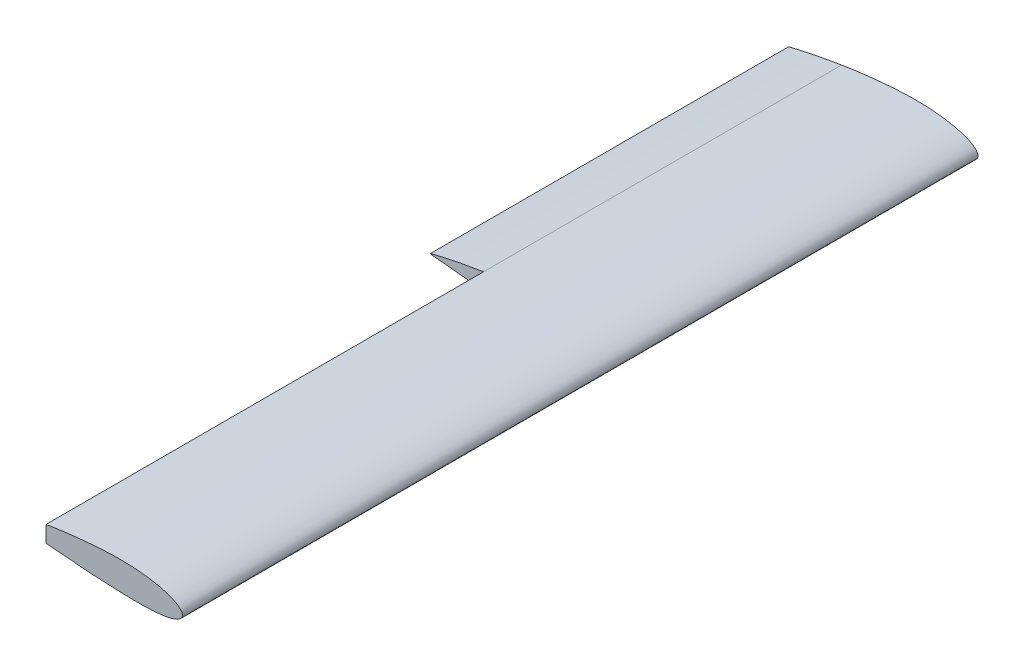
from build123d import *

# Parameters (mm, degrees)
BOSS_EXTRUDE1_DEPTH = 1120
BOSS_EXTRUDE2_DEPTH = 504
SKETCH3_R           = 12.7
CUT_EXTRUDE1_DEPTH  = 801
SKETCH4_W           = 32
SKETCH4_H           = 36.699
CUT_EXTRUDE2_DEPTH  = 46
SKETCH5_W           = 60
SKETCH5_H           = 12
CUT_EXTRUDE3_DEPTH  = 46
SKETCH6_W           = 54
SKETCH6_H           = 29.1
CUT_EXTRUDE4_DEPTH  = 64
SKETCH7_W           = 20.4
SKETCH7_H           = 6.8
CUT_EXTRUDE5_DEPTH  = 26


with BuildPart() as part:
    # Sketch1 → Boss-Extrude1 (new body)
    with BuildSketch(Plane.XY):
        with BuildLine():
            Line((-191.93544, 15.415994386), (-191.93544, -7.690938633))
            add(Edge.make_bspline(
                [(-191.93544, 15.415994386), (-189.524263645, 15.800399619), (-183.840015022, 16.706619074), (-174.781136721, 18.029343411), (-164.699001073, 19.401069917), (-154.413191944, 20.673735856), (-143.988170783, 21.830432901), (-133.488738685, 22.849158456), (-122.980748105, 23.710765794), (-112.515417187, 24.396095093), (-102.139321575, 24.893723734), (-91.916475809, 25.125832859), (-81.930286803, 25.090046311), (-72.266831195, 24.780871286), (-62.991070612, 24.200812347), (-54.165224939, 23.356898581), (-45.848172705, 22.261450678), (-38.094792214, 20.931595824), (-30.955366589, 19.388795281), (-24.475027042, 17.658061869), (-18.693227651, 15.766937372), (-13.643188102, 13.744216819), (-9.351263596, 11.618189035), (-5.83608943, 9.414274451), (-3.108519117, 7.149904568), (-1.175256134, 4.827939872), (-0.063283786, 2.426466328), (0.145020659, -0.01456545), (-0.541831171, -2.364092475), (-2.092939689, -4.498687379), (-4.413682401, -6.404391962), (-7.476250194, -8.116874818), (-11.268094049, -9.647026376), (-15.771581276, -10.99526881), (-20.962122659, -12.158099265), (-26.809437569, -13.132372723), (-33.278882983, -13.916792281), (-40.332337427, -14.512824611), (-47.92878569, -14.925150527), (-56.024697843, -15.161881697), (-64.574273602, -15.234523302), (-73.529599748, -15.15778324), (-82.840735601, -14.948927871), (-92.455830845, -14.627964828), (-102.340307767, -14.21298414), (-112.453303072, -13.731946661), (-122.732635144, -13.141710162), (-133.097571213, -12.46700742), (-143.470724362, -11.725475749), (-153.789329166, -10.934787918), (-163.990582264, -10.110993441), (-174.011944986, -9.267782762), (-183.307195894, -8.462466506), (-189.254313127, -7.930681979), (-191.93544, -7.690938633)],
                knots=[0, 0, 0, 0, 0.018424224, 0.043434346, 0.069080412, 0.095203092, 0.121640117, 0.148227444, 0.17480049, 0.201195447, 0.227363977, 0.253181792, 0.278347264, 0.302710399, 0.326128333, 0.348466602, 0.369600377, 0.389415723, 0.407811011, 0.424698681, 0.44000774, 0.453687637, 0.465714725, 0.476103672, 0.484928355, 0.492360154, 0.498730164, 0.504586951, 0.510443348, 0.516803825, 0.524198712, 0.532940661, 0.543185695, 0.554995644, 0.568376342, 0.583298542, 0.599709376, 0.617538825, 0.636703502, 0.65710892, 0.678650912, 0.701216586, 0.724685048, 0.748928058, 0.7738107, 0.799337901, 0.825325561, 0.851504471, 0.877716004, 0.903800001, 0.929595993, 0.954944401, 0.979687675, 1, 1, 1, 1], degree=3))
        make_face()
    extrude(amount=BOSS_EXTRUDE1_DEPTH)

    # Sketch2 → Boss-Extrude2 (add)
    with BuildSketch(Plane.XY):
        with BuildLine():
            Line((-191.93544, 15.415994386), (-191.93544, -7.690938633))
            add(Edge.make_bspline(
                [(-191.93544, -7.690938633), (-192.420067172, -7.6478653), (-195.9504722, -7.334085307), (-202.385866532, -6.745023127), (-211.084168938, -5.940242123), (-219.309262382, -5.164593786), (-227.009250337, -4.427029261), (-234.135069499, -3.733617005), (-240.641108781, -3.090727292), (-246.485492948, -2.504721286), (-251.630355092, -1.980998465), (-256.042317782, -1.52735928), (-259.692220923, -1.143575748), (-262.556904408, -0.849913682), (-264.61546863, -0.612861211), (-265.858416096, -0.512805201), (-266.419029816, -0.418366575), (-266.567688701, -0.418895711), (-266.577, -0.418928854)],
                knots=[0, 0, 0, 0, 0.019462551, 0.14178051, 0.258505433, 0.368899529, 0.472261554, 0.567931303, 0.655293986, 0.733784513, 0.802891701, 0.862162346, 0.911205133, 0.949694244, 0.977372582, 0.994054454, 0.999627599, 1, 1, 1, 1], degree=3))
            Line((-266.577, -0.418928854), (-266.577, 0.425749675))
            add(Edge.make_bspline(
                [(-191.93544, 15.415994386), (-192.694105371, 15.297158223), (-196.500358816, 14.700952606), (-203.197962323, 13.562133744), (-211.868350415, 12.032890384), (-220.046599382, 10.510140605), (-227.684988534, 9.024362583), (-234.737630839, 7.595296544), (-241.162808355, 6.244967863), (-246.922671439, 4.994207922), (-251.983535359, 3.863075388), (-256.315994157, 2.870269248), (-259.895031117, 2.032695697), (-262.700108492, 1.365039114), (-264.715189952, 0.879184388), (-265.919534871, 0.586380331), (-266.450919413, 0.456553449), (-266.577, 0.425749675)],
                knots=[0, 0, 0, 0, 0.030251696, 0.151773928, 0.267626296, 0.377089872, 0.479484952, 0.574174897, 0.660569789, 0.738129949, 0.806369318, 0.864858701, 0.913228834, 0.951173208, 0.978450569, 0.994887008, 1, 1, 1, 1], degree=3))
        make_face()
    extrude(amount=BOSS_EXTRUDE2_DEPTH)

    # Sketch3 → Cut-Extrude1 (cut)
    with BuildSketch(Plane.XY):
        with Locations((-79.973, 4.998)):
            Circle(SKETCH3_R)
    extrude(amount=CUT_EXTRUDE1_DEPTH, mode=Mode.SUBTRACT)

    # Sketch4 → Cut-Extrude2 (cut)
    with BuildSketch(Plane.XY.offset(330.7)):
        with Locations((-79.973, 2.3485)):
            Rectangle(SKETCH4_W, SKETCH4_H)
    extrude(amount=CUT_EXTRUDE2_DEPTH, mode=Mode.SUBTRACT)

    # Sketch5 → Cut-Extrude3 (cut)
    with BuildSketch(Plane.XY.offset(330.7)):
        with Locations((-213.2616, -1.779)):
            Rectangle(SKETCH5_W, SKETCH5_H)
    extrude(amount=CUT_EXTRUDE3_DEPTH, mode=Mode.SUBTRACT)

    # Sketch6 → Cut-Extrude4 (cut)
    with BuildSketch(Plane.XY.offset(534.5)):
        with Locations((-146.617, 0.046)):
            Rectangle(SKETCH6_W, SKETCH6_H)
    extrude(amount=CUT_EXTRUDE4_DEPTH, mode=Mode.SUBTRACT)

    # Sketch7 → Cut-Extrude5 (cut)
    with BuildSketch(Plane.XY.offset(-0.5)):
        with Locations((-186.604, 3.999)):
            Rectangle(SKETCH7_W, SKETCH7_H)
    extrude(amount=CUT_EXTRUDE5_DEPTH, mode=Mode.SUBTRACT)


solid = part.part
